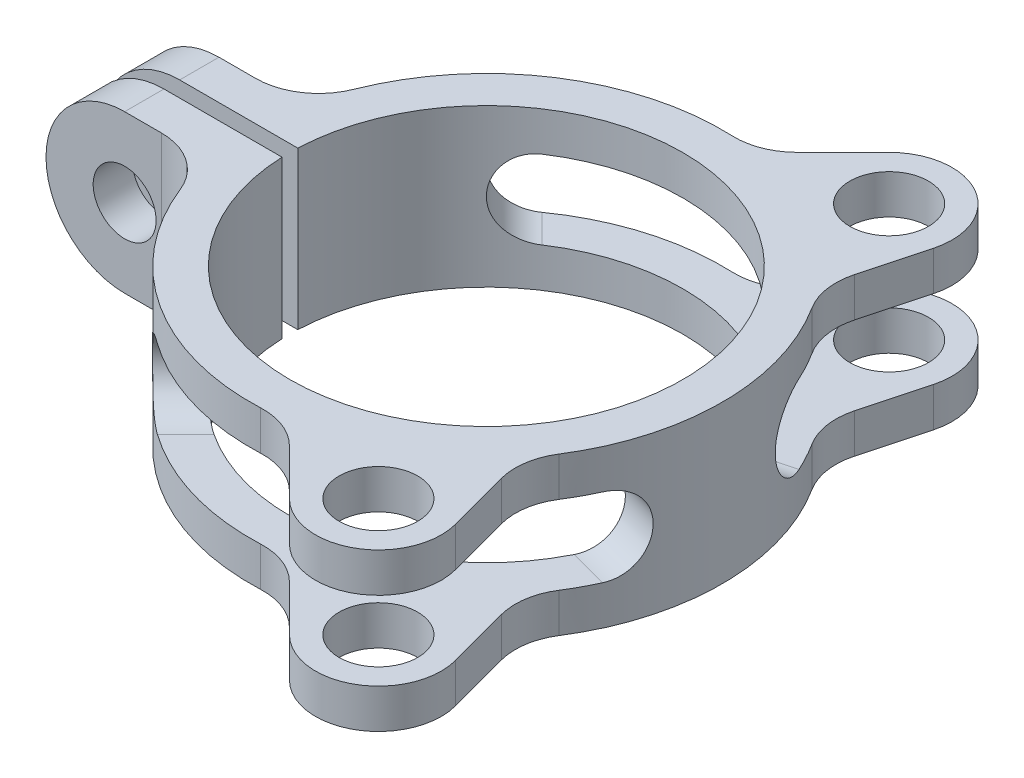
from build123d import *

# Parameters (mm, degrees)
SKETCH1_R               = 5
SKETCH1_R_2             = 25
BOSS_EXTRUDE1_DEPTH     = 20
FILLET1_R               = 8
CUT_EXTRUDE4_START      = 5
CUT_EXTRUDE4_DEPTH      = 10
FILLET4_R               = 5
FILLET5_R               = 5
FILLET6_R               = 5
FILLET7_R               = 5
CUT_EXTRUDE5_DEPTH      = 68.366926205
CUT_EXTRUDE5_DEPTH_BACK = 68.366926205
SKETCH9_R               = 4
CUT_EXTRUDE6_DEPTH      = 68.366926205
CUT_EXTRUDE6_DEPTH_BACK = 68.366926205
SKETCH10_W              = 39.746236579
SKETCH10_H              = 2


with BuildPart() as part:
    # Sketch1 → Boss-Extrude1 (new body)
    with BuildSketch(Plane(origin=(0, 0, 0), x_dir=(1, 0, 0), z_dir=(0, 1, 0))):
        with BuildLine():
            ThreePointArc((13.093145751, -38.132806891), (22.75, -39.404155872), (26.47740661, -30.405400281))
            Line((26.47740661, -30.405400281), (23.370465731, -18.810139062))
            ThreePointArc((23.370465731, -18.810139062), (30, 0), (23.370465731, 18.810139062))
            Line((23.370465731, 18.810139062), (26.47740661, 30.405400281))
            ThreePointArc((26.47740661, 30.405400281), (22.75, 39.404155872), (13.093145751, 38.132806891))
            Line((13.093145751, 38.132806891), (4.604825411, 29.644486552))
            ThreePointArc((4.604825411, 29.644486552), (-17.128622381, 24.629459907), (-29.393876913, 6))
            Line((-29.393876913, 6), (-50, 6))
            Line((-50, 6), (-50, -6))
            Line((-50, -6), (-29.393876913, -6))
            ThreePointArc((-29.393876913, -6), (-17.128622381, -24.629459907), (4.604825411, -29.644486552))
            Line((4.604825411, -29.644486552), (13.093145751, -38.132806891))
        make_face()
        with Locations(Location((18.75, -32.475952642, 0), (0, 0, 270))):
            Circle(SKETCH1_R, mode=Mode.SUBTRACT)
        with Locations(Location((0, 0, 0), (0, 0, 270))):
            Circle(SKETCH1_R_2, mode=Mode.SUBTRACT)
        with Locations(Location((18.75, 32.475952642, 0), (0, 0, 270))):
            Circle(SKETCH1_R, mode=Mode.SUBTRACT)
    extrude(amount=BOSS_EXTRUDE1_DEPTH)

    # Fillet1
    fillet1_edges = [part.edges().sort_by_distance(p)[0] for p in [
        (23.370465731, 10, -18.810139062),
        (23.370465731, 10, 18.810139062),
        (4.604825411, 10, 29.644486552),
        (-29.393876913, 10, 6),
        (-29.393876913, 10, -6),
        (4.604825411, 10, -29.644486552),
    ]]
    fillet(fillet1_edges, radius=FILLET1_R)

    # Sketch8 → Cut-Extrude4 (cut)
    with BuildSketch(Plane(origin=(0, 0, 0), x_dir=(1, 0, 0), z_dir=(0, 1, 0)).offset(CUT_EXTRUDE4_START)):
        Polygon((0, 0), (112.790369841, -30.222088513), (-54.928380423, -54.928380423), align=None)
        Polygon((0, 0), (-54.928380423, 54.928380423), (112.790369841, 30.222088513), align=None)
    extrude(amount=CUT_EXTRUDE4_DEPTH, mode=Mode.SUBTRACT)

    # Fillet4
    fillet4_edges = [part.edges().sort_by_distance(p)[0] for p in [
        (-19.445436483, 5, 19.445436483),
        (-19.445436483, 15, 19.445436483),
    ]]
    fillet(fillet4_edges, radius=FILLET4_R - 0.0001)  # a hair under: the kernel refuses the full size

    # Fillet5
    fillet5_edges = [part.edges().sort_by_distance(p)[0] for p in [
        (26.562960223, 15, 7.11752374),
        (26.562960223, 5, 7.11752374),
    ]]
    fillet(fillet5_edges, radius=FILLET5_R - 0.0001)  # a hair under: the kernel refuses the full size

    # Fillet6
    fillet6_edges = [part.edges().sort_by_distance(p)[0] for p in [
        (26.562960223, 5, -7.11752374),
        (26.562960223, 15, -7.11752374),
    ]]
    fillet(fillet6_edges, radius=FILLET6_R - 0.0001)  # a hair under: the kernel refuses the full size

    # Fillet7
    fillet7_edges = [part.edges().sort_by_distance(p)[0] for p in [
        (-19.445436483, 15, -19.445436483),
        (-19.445436483, 5, -19.445436483),
    ]]
    fillet(fillet7_edges, radius=FILLET7_R - 0.0001)  # a hair under: the kernel refuses the full size

    # Sketch9 → Cut-Extrude5 (cut, two sides: drawn at the far end of the back side and taken through both)
    with BuildSketch(Plane.XY.offset(-CUT_EXTRUDE5_DEPTH_BACK)):
        with BuildLine():
            ThreePointArc((-50, 10), (-47.071067812, 17.071067812), (-40, 20))
            Line((-40, 20), (-50, 20))
            Line((-50, 20), (-50, 10))
        make_face()
        with BuildLine():
            ThreePointArc((-40, 0), (-47.071067812, 2.928932188), (-50, 10))
            Line((-50, 10), (-50, 0))
            Line((-50, 0), (-40, 0))
        make_face()
        with Locations((-40, 10)):
            Circle(SKETCH9_R)
    extrude(amount=CUT_EXTRUDE5_DEPTH + CUT_EXTRUDE5_DEPTH_BACK, mode=Mode.SUBTRACT)

    # Sketch10 → Cut-Extrude6 (cut, two sides: drawn at the far end of the back side and taken through both)
    with BuildSketch(Plane(origin=(0, 20, 0), x_dir=(1, 0, 0), z_dir=(0, 1, 0)).offset(-CUT_EXTRUDE6_DEPTH_BACK)):
        with Locations((-38.779837972, 0)):
            Rectangle(SKETCH10_W, SKETCH10_H)
    extrude(amount=CUT_EXTRUDE6_DEPTH + CUT_EXTRUDE6_DEPTH_BACK, mode=Mode.SUBTRACT)


solid = part.part
